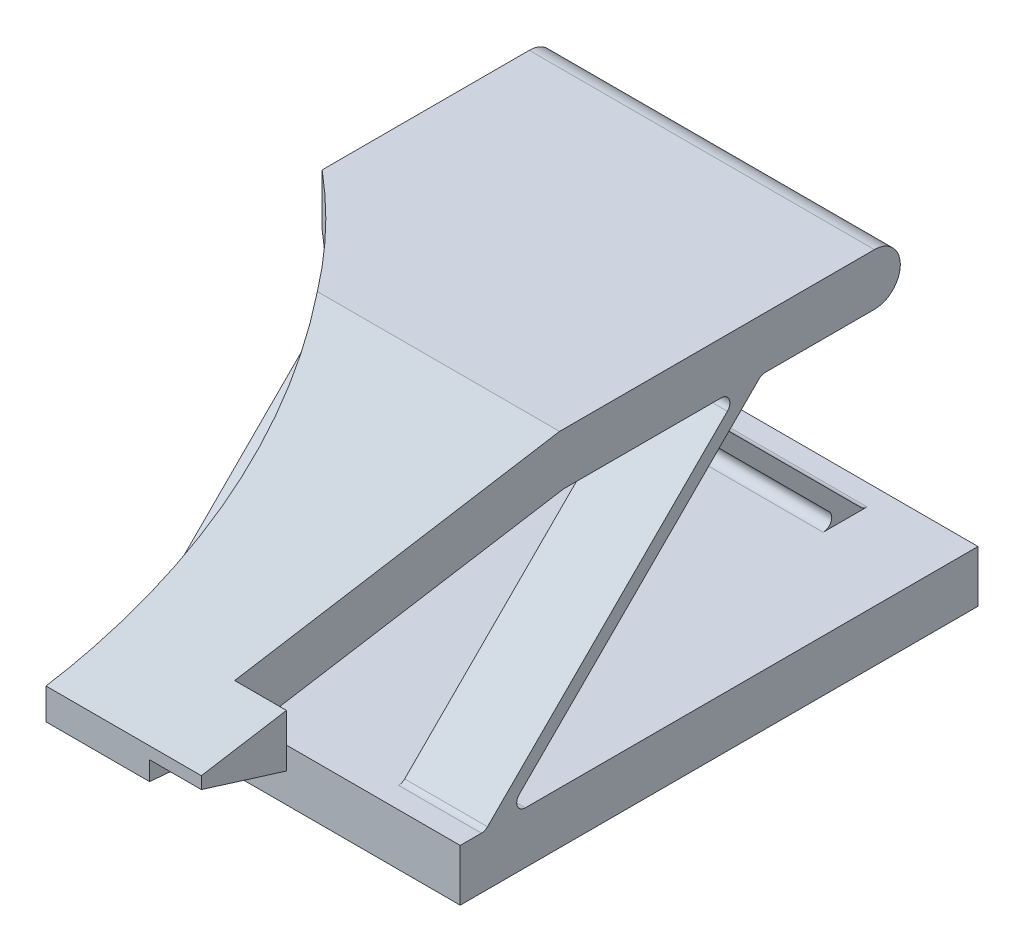
from build123d import *

# Parameters (mm, degrees)
BOSS_EXTRUDE1_DEPTH   = 10
SKETCH1_W             = 30
SKETCH1_H             = 3
BOSS_EXTRUDE1_2_DEPTH = 10
BOSS_EXTRUDE2_DEPTH   = 4.8
BOSS_EXTRUDE3_START   = 5.2
BOSS_EXTRUDE3_DEPTH   = 4.8
FILLET1_R             = 0.5
CUT_EXTRUDE2_REACH    = 55.298
BOSS_EXTRUDE4_DEPTH   = 3


with BuildPart() as part:
    # Sketch1 → Boss-Extrude1 (new, symmetric)
    with BuildSketch(Plane(origin=(0, 0, 0), x_dir=(0, 0, -1), z_dir=(1, 0, 0))):
        with BuildLine():
            Line((0, 13), (0, 11.2))
            Line((0, 11.2), (4.930378913, 10.768647738))
            Line((4.930378913, 10.768647738), (24, 13.896674439))
            Line((24, 13.896674439), (42, 13.896674439))
            ThreePointArc((42, 13.896674439), (43.5, 15.396674439), (42, 16.896674439))
            Line((42, 16.896674439), (23.755585281, 16.896674439))
            Line((23.755585281, 16.896674439), (0, 13))
        make_face()
    extrude(amount=BOSS_EXTRUDE1_DEPTH, both=True)



with BuildPart() as body_2:
    # Sketch1 → Boss-Extrude1 2 (new, symmetric)
    with BuildSketch(Plane(origin=(0, 0, 0), x_dir=(0, 0, -1), z_dir=(1, 0, 0))):
        with Locations((33, -2.5)):
            Rectangle(SKETCH1_W, SKETCH1_H)
    extrude(amount=BOSS_EXTRUDE1_2_DEPTH, both=True)


with BuildPart() as part_1:
    add(part.part)

    add(body_2.part)  # Boss-Extrude2 merges body 2
    # Sketch2 → Boss-Extrude2 (add, symmetric)
    with BuildSketch(Plane(origin=(0, 0, 0), x_dir=(0, 0, -1), z_dir=(1, 0, 0))):
        Polygon((30.537640136, 13.896674439), (45.434314575, -1), (46.565685425, -1), (31.669010986, 13.896674439), align=None)
    extrude(amount=BOSS_EXTRUDE2_DEPTH, both=True)

    # Sketch3 → Boss-Extrude3 (add)
    with BuildSketch(Plane(origin=(0, 0, 0), x_dir=(0, 0, -1), z_dir=(1, 0, 0)).offset(BOSS_EXTRUDE3_START)):
        Polygon((19.434314575, -1), (20.565685425, -1), (35.462359864, 13.896674439), (34.330989014, 13.896674439), align=None)
    boss_extrude3 = extrude(amount=BOSS_EXTRUDE3_DEPTH)

    # Mirror1: Boss-Extrude3 across plane
    add(boss_extrude3.mirror(Plane(origin=(0, 0, 0), x_dir=(0, 0, 1), z_dir=(1, 0, 0))))

    # Fillet1
    fillet1_edges = [part_1.edges().sort_by_distance(p)[0] for p in [
        (-7.6, -1, -20.565685425),
        (-7.6, -1, -19.434314575),
        (7.6, -1, -19.434314575),
        (7.6, -1, -20.565685425),
        (0, -1, -45.434314575),
        (0, -1, -46.565685425),
        (0, 13.896674439, -31.669010986),
        (0, 13.896674439, -30.537640136),
        (7.6, 13.896674439, -34.330989014),
        (7.6, 13.896674439, -35.462359864),
    ]]
    fillet(fillet1_edges, radius=FILLET1_R)

    # Sketch5 → Cut-Extrude2 (cut, up to next)
    with BuildSketch(Plane(origin=(0, 16.896674439, 0), x_dir=(1, 0, 0), z_dir=(0, 1, 0)), mode=Mode.PRIVATE) as cut_extrude2_sk1:
        with BuildLine():
            Line((-10, 0), (-10, 30))
            ThreePointArc((-10, 30), (0.327740051, 16.552945357), (4, 0))
            Line((4, 0), (-10, 0))
        make_face()
    cut_extrude2_tool1 = extrude(cut_extrude2_sk1.sketch, amount=-CUT_EXTRUDE2_REACH, mode=Mode.PRIVATE) & part_1.part
    add(cut_extrude2_tool1.solids().sort_by_distance((-4.304172, 16.896674, -11.577071))[0], mode=Mode.SUBTRACT)

    # Sketch6 → Boss-Extrude4 (add)
    with BuildSketch(Plane(origin=(10, 0, 0), x_dir=(0, 0, -1), z_dir=(1, 0, 0))):
        Polygon((0, 13), (4.930378913, 13.808739556), (4.930378913, 10.768647738), (0, 12.3), align=None)
    extrude(amount=BOSS_EXTRUDE4_DEPTH)


solid = part_1.part
